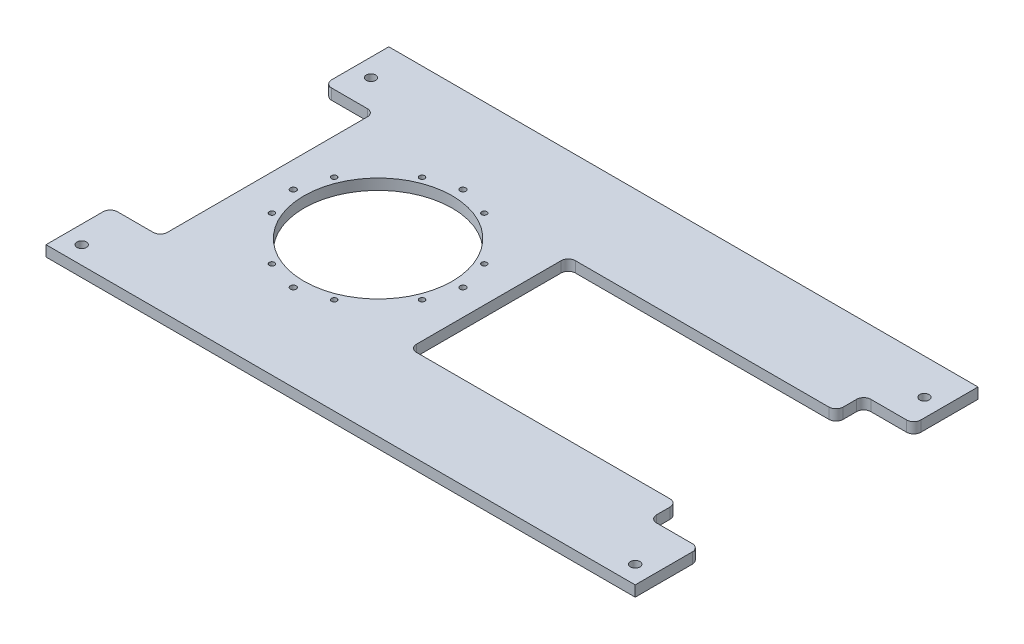
from build123d import *

# Parameters (mm, degrees)
SKETCH1_W                = 330
SKETCH1_H                = 192
BOSS_EXTRUDE1_DEPTH      = 6
CUT_EXTRUDE1_DEPTH       = 382.837661841
CUT_EXTRUDE1_DEPTH_BACK  = 382.837661841
SKETCH2_R                = 1.5
SKETCH3_R                = 41.5
CUT_EXTRUDE2_DEPTH       = 382.837661841
M5_CLEARANCE_HOLE1_D     = 5.3
M5_CLEARANCE_HOLE1_DEPTH = 11.94
M5_CLEARANCE_HOLE1_TIP   = 1.59228064
TAP_DRILL_FOR_M4_TAP1_D  = 3.3
CUT_EXTRUDE3_DEPTH       = 382.837661841
CUT_EXTRUDE3_DEPTH_BACK  = 382.837661841
SKETCH19_W               = 28
SKETCH19_H               = 120
SKETCH21_W               = 150
SKETCH21_H               = 89
CUT_EXTRUDE4_DEPTH       = 382.837661841
FILLET1_R                = 4


with BuildPart() as part:
    # Sketch1 → Boss-Extrude1 (new body)
    with BuildSketch(Plane(origin=(0, 0, 0), x_dir=(1, 0, 0), z_dir=(0, 1, 0))):
        with Locations((165, 96)):
            Rectangle(SKETCH1_W, SKETCH1_H)
    extrude(amount=BOSS_EXTRUDE1_DEPTH)

    # Sketch2 → Cut-Extrude1 (cut, two sides: drawn at the far end of the back side and taken through both)
    with BuildSketch(Plane(origin=(0, 6, 0), x_dir=(1, 0, 0), z_dir=(0, 1, 0)).offset(-CUT_EXTRUDE1_DEPTH_BACK)):
        with Locations((132.036518729, 113.412096173)):
            Circle(SKETCH2_R)
        with Locations((132.036518729, 78.587903827)):
            Circle(SKETCH2_R)
        with Locations((107.412096173, 53.963481271)):
            Circle(SKETCH2_R)
        with Locations((72.587903827, 53.963481271)):
            Circle(SKETCH2_R)
        with Locations((47.963481271, 78.587903827)):
            Circle(SKETCH2_R)
        with Locations((47.963481271, 113.412096173)):
            Circle(SKETCH2_R)
        with Locations((72.587903827, 138.036518729)):
            Circle(SKETCH2_R)
        with Locations((107.412096173, 138.036518729)):
            Circle(SKETCH2_R)
    extrude(amount=CUT_EXTRUDE1_DEPTH + CUT_EXTRUDE1_DEPTH_BACK, mode=Mode.SUBTRACT)

    # Sketch3 → Cut-Extrude2 (cut, through all)
    with BuildSketch(Plane(origin=(0, 6, 0), x_dir=(1, 0, 0), z_dir=(0, 1, 0))):
        with Locations((90, 96)):
            Circle(SKETCH3_R)
    extrude(amount=-CUT_EXTRUDE2_DEPTH, mode=Mode.SUBTRACT)

    # M5 Clearance Hole1
    with Locations(Plane(origin=(0, 6, 0), x_dir=(1, 0, 0), z_dir=(0, 1, 0))):
        with Locations((10, 172), (10, 10), (320, 10), (320, 172)):
            Hole(M5_CLEARANCE_HOLE1_D / 2, depth=M5_CLEARANCE_HOLE1_DEPTH)
            with Locations((0, 0, -(M5_CLEARANCE_HOLE1_DEPTH + M5_CLEARANCE_HOLE1_TIP / 2))):  # 118° drill point
                Cone(0, M5_CLEARANCE_HOLE1_D / 2, M5_CLEARANCE_HOLE1_TIP, mode=Mode.SUBTRACT)

    # Tap Drill for M4 Tap1 (through all)
    with Locations(Plane(origin=(0, 6, 0), x_dir=(1, 0, 0), z_dir=(0, 1, 0))):
        with Locations((137.5, 96), (90, 48.5), (42.5, 96), (90, 143.5)):
            Hole(TAP_DRILL_FOR_M4_TAP1_D / 2)

    # Sketch19 → Cut-Extrude3 (cut, two sides: drawn at the far end of the back side and taken through both)
    with BuildSketch(Plane(origin=(0, 6, 0), x_dir=(1, 0, 0), z_dir=(0, 1, 0)).offset(-CUT_EXTRUDE3_DEPTH_BACK)):
        with Locations((14, 96)):
            Rectangle(SKETCH19_W, SKETCH19_H)
        with Locations((316, 96)):
            Rectangle(SKETCH19_W, SKETCH19_H)
    extrude(amount=CUT_EXTRUDE3_DEPTH + CUT_EXTRUDE3_DEPTH_BACK, mode=Mode.SUBTRACT)

    # Sketch21 → Cut-Extrude4 (cut, through all)
    with BuildSketch(Plane.XZ):
        with Locations((227, -96)):
            Rectangle(SKETCH21_W, SKETCH21_H)
    extrude(amount=-CUT_EXTRUDE4_DEPTH, mode=Mode.SUBTRACT)

    # Fillet1
    fillet1_edges = [part.edges().sort_by_distance(p)[0] for p in [
        (330, 3, -36),
        (302, 3, -36),
        (330, 3, -156),
        (302, 3, -156),
        (28, 3, -156),
        (28, 3, -36),
        (0, 3, -36),
        (0, 3, -156),
        (152, 3, -51.5),
        (152, 3, -140.5),
        (302, 3, -140.5),
        (302, 3, -51.5),
    ]]
    fillet(fillet1_edges, radius=FILLET1_R)


solid = part.part
